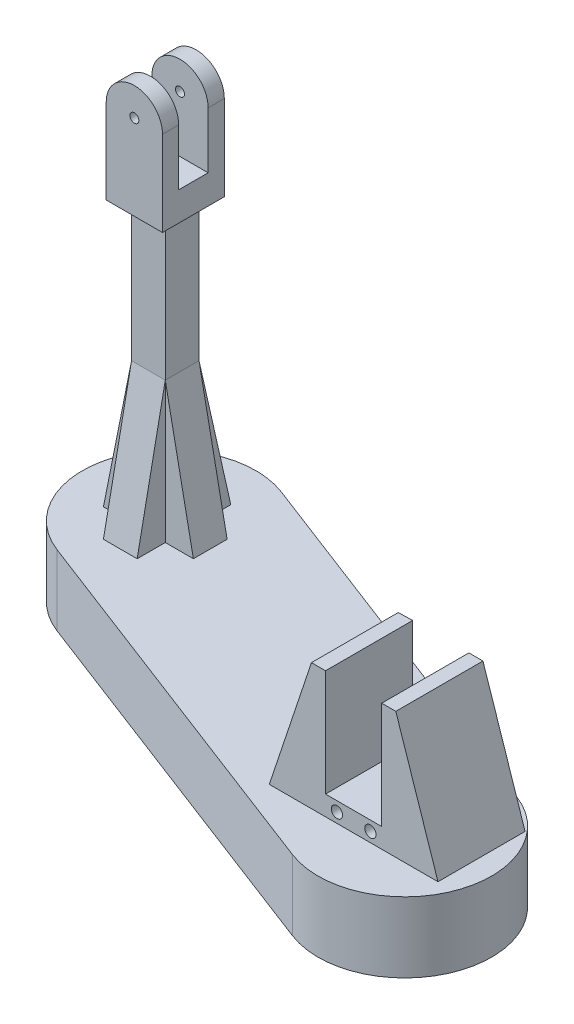
from build123d import *

# Parameters (mm, degrees)
EXTRUDE_1_DEPTH      = 12
CUT_EXTRUDE_1_DEPTH  = 39.218600963
CUT_EXTRUDE_6_DEPTH  = 39.218600963
SKETCH_12_R          = 1.6
EXTRUDE_11_DEPTH     = 5
EXTRUDE_START        = 5
SKETCH_13_R          = 1.6
EXTRUDE_12_DEPTH     = 5
SKETCH_14_W          = 10.08
SKETCH_14_H          = 30
CUT_EXTRUDE_7_DEPTH  = 41.070705753
SKETCH_15_W          = 12
SKETCH_15_H          = 12
EXTRUDE_13_DEPTH     = 100
SKETCH_16_W          = 237
SKETCH_16_H          = 150
EXTRUDE_14_DEPTH     = 25
EXTRUDE_19_DEPTH     = 7
SKETCH_31_W          = 5
SKETCH_31_H          = 31
EXTRUDE_20_DEPTH     = 45
EXTRUDE_21_DEPTH     = 31
SKETCH_35_R          = 2
CUT_EXTRUDE_16_DEPTH = 252.729549014
SKETCH_38_W          = 10.48
SKETCH_38_H          = 30
CUT_EXTRUDE_18_DEPTH = 261.619964405
FILLET_2_R           = 10
EXTRUDE_22_DEPTH     = 12
EXTRUDE_23_DEPTH     = 12
SKETCH_43_W          = 261.871256573
SKETCH_43_H          = 176.72808866
CUT_EXTRUDE_19_DEPTH = 245.682392746


with BuildPart() as part:
    # 草圖1 → 填料-伸長1 (new body)
    with BuildSketch(Plane.XY):
        with BuildLine():
            ThreePointArc((10, 0), (0, 10), (-10, 0))
            Line((-10, 0), (-10, -30.276417548))
            Line((-10, -30.276417548), (10, -30.276417548))
            Line((10, -30.276417548), (10, 0))
        make_face()
        with BuildLine():
            ThreePointArc((0, -1.6), (-1.13137085, 1.13137085), (1.6, 0))
            ThreePointArc((1.6, 0), (1.13137085, -1.13137085), (0, -1.6))
        make_face(mode=Mode.SUBTRACT)
    extrude(amount=EXTRUDE_1_DEPTH)

    # 草圖2 → 除料-伸長1 (cut, through all)
    with BuildSketch(Plane(origin=(10, 0, 0), x_dir=(0, 0, -1), z_dir=(1, 0, 0))):
        Polygon((-9, 15.780779257), (-9, 0), (-8.60053373, -20), (-3, -20), (-3, 15.780779257), align=None)
    extrude(amount=-CUT_EXTRUDE_1_DEPTH, mode=Mode.SUBTRACT)

    # 草圖11 → 除料-伸長6 (cut, through all)
    with BuildSketch(Plane(origin=(10, 0, 0), x_dir=(0, 0, -1), z_dir=(1, 0, 0))):
        Polygon((-9, 0), (-9, -20), (-8.60053373, -20), align=None)
    extrude(amount=-CUT_EXTRUDE_6_DEPTH, mode=Mode.SUBTRACT)

    # 草圖12 → 填料-伸長11 (add)
    with BuildSketch(Plane.XY.offset(12)):
        with BuildLine():
            Line((10, -30.276417548), (10, 0))
            ThreePointArc((10, 0), (0, 10), (-10, 0))
            Line((-10, 0), (-10, -30.276417548))
            Line((-10, -30.276417548), (10, -30.276417548))
        make_face()
        Circle(SKETCH_12_R, mode=Mode.SUBTRACT)
    extrude(amount=EXTRUDE_11_DEPTH)

    # 草圖13 → 填料-伸長12 (add)
    with BuildSketch(Plane(origin=(0, 0, 0), x_dir=(-1, 0, 0), z_dir=(0, 0, -1)).offset(EXTRUDE_START)):
        with BuildLine():
            Line((10, -30.276417548), (10, 0))
            ThreePointArc((10, 0), (0, 10), (-10, 0))
            Line((-10, 0), (-10, -30.276417548))
            Line((-10, -30.276417548), (10, -30.276417548))
        make_face()
        Circle(SKETCH_13_R, mode=Mode.SUBTRACT)
    extrude(amount=-EXTRUDE_12_DEPTH)

    # 草圖14 → 除料-伸長7 (cut, through all)
    with BuildSketch(Plane.ZY.offset(10)):
        with Locations((6, -5)):
            Rectangle(SKETCH_14_W, SKETCH_14_H)
    extrude(amount=-CUT_EXTRUDE_7_DEPTH, mode=Mode.SUBTRACT)

    # 草圖15 → 填料-伸長13 (add)
    with BuildSketch(Plane.XZ.offset(30.276417548)):
        with Locations((0, 6)):
            Rectangle(SKETCH_15_W, SKETCH_15_H)
    extrude(amount=EXTRUDE_13_DEPTH)

    # 草圖16 → 填料-伸長14 (add)
    with BuildSketch(Plane.XZ.offset(130.276417548)):
        with Locations((57.5, 21)):
            Rectangle(SKETCH_16_W, SKETCH_16_H)
    extrude(amount=EXTRUDE_14_DEPTH)

    # 草圖30 → 填料-伸長19 (add)
    with BuildSketch(Plane(origin=(0, -130.276417548, 0), x_dir=(1, 0, 0), z_dir=(0, 1, 0))):
        Polygon((139, -37), (129, -37), (119, -37), (119, -68), (139, -68), align=None)
    extrude(amount=EXTRUDE_19_DEPTH)

    # 草圖31 → 填料-伸長20 (add)
    with BuildSketch(Plane(origin=(0, -130.276417548, 0), x_dir=(1, 0, 0), z_dir=(0, 1, 0))):
        Polygon((119, -68), (114, -68), (114, -37.129725066), (119, -37), align=None)
        with Locations((141.5, -52.5)):
            Rectangle(SKETCH_31_W, SKETCH_31_H)
    extrude(amount=EXTRUDE_20_DEPTH)

    # 草圖33 → 填料-伸長21 (add)
    with BuildSketch(Plane.XY.offset(68)):
        Polygon((114, -130.276417548), (114, -85.276417548), (99, -130.276417548), align=None)
        Polygon((159, -130.276417548), (144, -85.276417548), (144, -130.276417548), align=None)
    extrude(amount=-EXTRUDE_21_DEPTH)

    # 草圖35 → 除料-伸長16 (cut, through all)
    with BuildSketch(Plane(origin=(0, 0, 37), x_dir=(-1, 0, 0), z_dir=(0, 0, -1))):
        with Locations((-134.95, -126.776417548)):
            Circle(SKETCH_35_R)
        with Locations((-123.05, -126.776417548)):
            Circle(SKETCH_35_R)
    extrude(amount=-CUT_EXTRUDE_16_DEPTH, mode=Mode.SUBTRACT)

    # 草圖38 → 除料-伸長18 (cut, through all)
    with BuildSketch(Plane.ZY.offset(10)):
        with Locations((6, -5)):
            Rectangle(SKETCH_38_W, SKETCH_38_H)
    extrude(amount=-CUT_EXTRUDE_18_DEPTH, mode=Mode.SUBTRACT)

    # 圓角2
    fillet_2_edges = [part.edges().sort_by_distance(p)[0] for p in [
        (176, -142.776417548, -54),
        (176, -142.776417548, 96),
        (-61, -142.776417548, -54),
        (-61, -142.776417548, 96),
    ]]
    fillet(fillet_2_edges, radius=FILLET_2_R)

    # 草圖39 → 填料-伸長22 (add)
    with BuildSketch(Plane(origin=(0, 0, 0), x_dir=(-1, 0, 0), z_dir=(0, 0, -1))):
        Polygon((-6, -80.276417548), (-16, -130.276417548), (-6, -130.276417548), align=None)
        Polygon((6, -80.276417548), (16, -130.276417548), (6, -130.276417548), align=None)
    extrude(amount=-EXTRUDE_22_DEPTH)

    # 草圖40 → 填料-伸長23 (add)
    with BuildSketch(Plane(origin=(6, 0, 0), x_dir=(0, 0, -1), z_dir=(1, 0, 0))):
        Polygon((-12, -80.276417548), (-22, -130.276417548), (-12, -130.276417548), align=None)
        Polygon((0, -80.276417548), (11.303196885, -130.276417548), (0, -130.276417548), align=None)
    extrude(amount=-EXTRUDE_23_DEPTH)

    # 草圖43 → 除料-伸長19 (cut, through all)
    with BuildSketch(Plane(origin=(0, -130.276417548, 0), x_dir=(1, 0, 0), z_dir=(0, 1, 0))):
        with Locations((55.959580844, -20.71992379)):
            Rectangle(SKETCH_43_W, SKETCH_43_H)
        with BuildLine():
            Line((11.052986493, 24.223320217), (146.97432536, -27.870854887))
            ThreePointArc((146.97432536, -27.870854887), (164.760200785, -67.762703298), (124.868352374, -85.548578724))
            Line((124.868352374, -85.548578724), (-11.052986493, -33.454403619))
            ThreePointArc((-11.052986493, -33.454403619), (-28.838861918, 6.437444792), (11.052986493, 24.223320217))
        make_face(mode=Mode.SUBTRACT)
    extrude(amount=-CUT_EXTRUDE_19_DEPTH, mode=Mode.SUBTRACT)


solid = part.part
